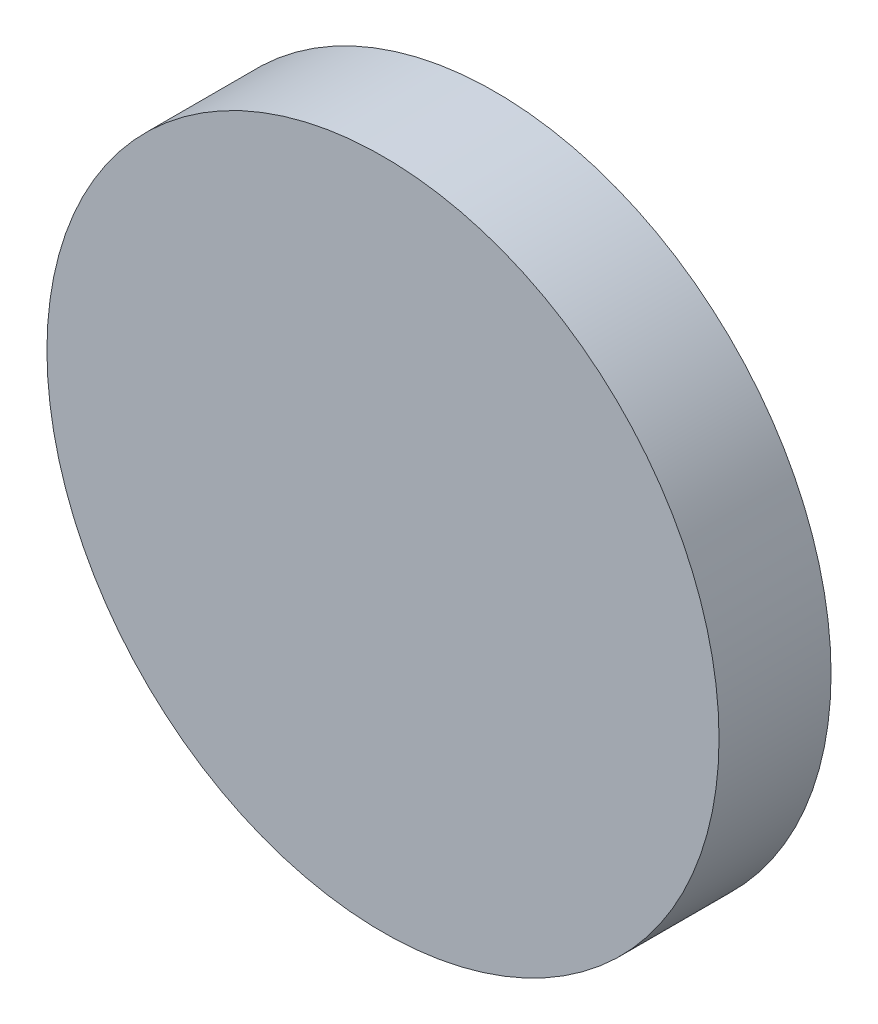
from build123d import *

# Parameters (mm, degrees)
SKETCH1_R           = 30
BOSS_EXTRUDE1_DEPTH = 10


with BuildPart() as part:
    # Sketch1 → Boss-Extrude1 (new body)
    with BuildSketch(Plane.XY):
        Circle(SKETCH1_R)
    extrude(amount=BOSS_EXTRUDE1_DEPTH)


solid = part.part
